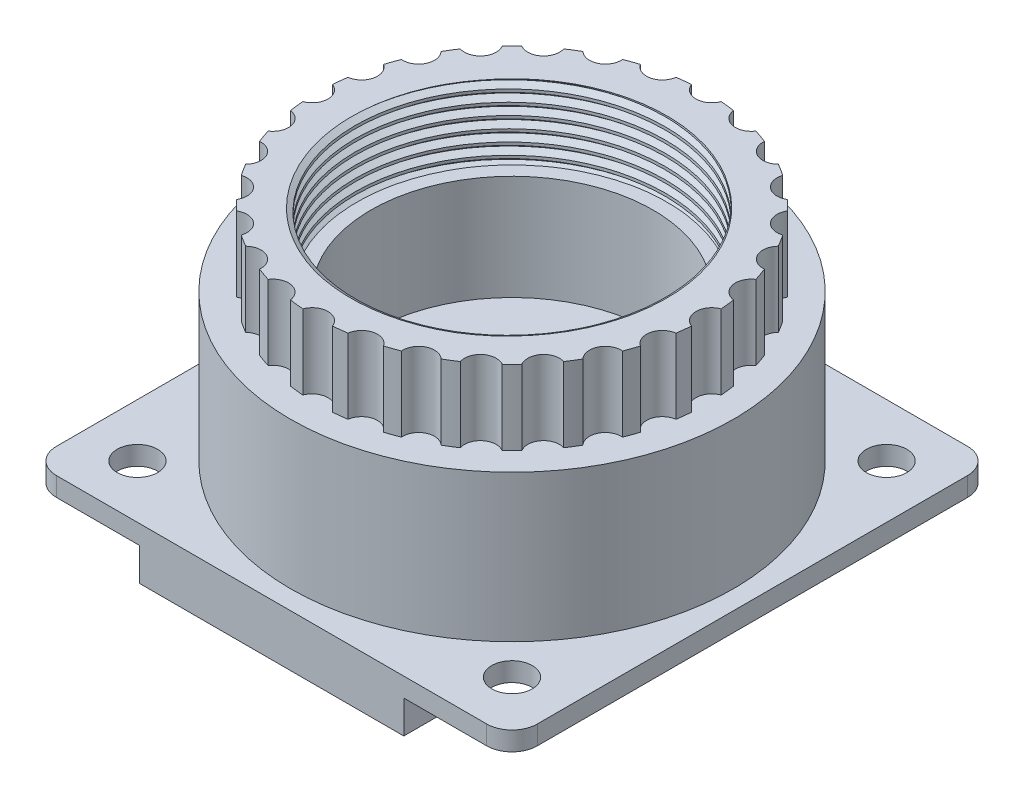
from build123d import *

# Parameters (mm, degrees)
SKETCH1_W             = 38
SKETCH1_H             = 38
SKETCH1_R             = 1.6
BOSS_EXTRUDE1_DEPTH   = 0.75
SKETCH2_W             = 20.9
SKETCH2_H             = 5.7
BOSS_EXTRUDE2_DEPTH   = 2.6
SKETCH13_W            = 7.25
SKETCH13_H            = 4.5
BOSS_EXTRUDE8_DEPTH   = 0.25
SKETCH3_R             = 1.775
BOSS_EXTRUDE3_DEPTH   = 3.25
BOSS_EXTRUDE3_2_DEPTH = 3.25
SKETCH4_R             = 17.5
SKETCH4_R_2           = 11.15
BOSS_EXTRUDE4_DEPTH   = 11.6
CUT_EXTRUDE2_START    = -1.5
SKETCH14_R            = 0.7
CUT_EXTRUDE2_DEPTH    = 6.5
SKETCH5_R             = 15.4
SKETCH5_R_2           = 12.24
BOSS_EXTRUDE5_DEPTH   = 5.9
THREAD1_PITCH         = 0.907142857
SKETCH10_R            = 1.25
CUT_EXTRUDE1_DEPTH    = 5.9
CIRPATTERN1_COUNT     = 28
SKETCH11_R            = 11.15
SKETCH11_W            = 9
SKETCH11_H            = 8
BOSS_EXTRUDE6_DEPTH   = 3.3
SKETCH15_R            = 0.7
BOSS_EXTRUDE9_DEPTH   = 6
FILLET1_R             = 2


with BuildPart() as part:
    # Sketch1 → Boss-Extrude1 (new, symmetric)
    with BuildSketch(Plane(origin=(0, 0, 0), x_dir=(1, 0, 0), z_dir=(0, 1, 0))):
        Rectangle(SKETCH1_W, SKETCH1_H)
        with Locations(Location((-14.8, 14.8, 0), (0, 0, 270))):
            Circle(SKETCH1_R, mode=Mode.SUBTRACT)
        with Locations(Location((-14.8, -14.8, 0), (0, 0, 270))):
            Circle(SKETCH1_R, mode=Mode.SUBTRACT)
        with Locations(Location((14.8, -14.8, 0), (0, 0, 270))):
            Circle(SKETCH1_R, mode=Mode.SUBTRACT)
        with Locations(Location((14.8, 14.8, 0), (0, 0, 270))):
            Circle(SKETCH1_R, mode=Mode.SUBTRACT)
    extrude(amount=BOSS_EXTRUDE1_DEPTH, both=True)

    # Sketch2 → Boss-Extrude2 (add)
    with BuildSketch(Plane.XZ.offset(0.75)):
        with Locations((0, 16.15)):
            Rectangle(SKETCH2_W, SKETCH2_H)
    extrude(amount=BOSS_EXTRUDE2_DEPTH)

    # Sketch13 → Boss-Extrude8 (add)
    with BuildSketch(Plane(origin=(0, 0.75, 0), x_dir=(1, 0, 0), z_dir=(0, 1, 0))):
        Rectangle(SKETCH13_W, SKETCH13_H)
    extrude(amount=BOSS_EXTRUDE8_DEPTH)


with BuildPart() as body_2:
    # Sketch3 → Boss-Extrude3 (new body)
    with BuildSketch(Plane.XZ.offset(0.75)):
        with Locations(Location((-12.125, 0, 0), (0, 0, 90))):
            Circle(SKETCH3_R)
    extrude(amount=BOSS_EXTRUDE3_DEPTH)


with BuildPart() as body_3:
    # Sketch3 → Boss-Extrude3 2 (new body)
    with BuildSketch(Plane.XZ.offset(0.75)):
        with Locations(Location((12.125, 0, 0), (0, 0, 90))):
            Circle(SKETCH3_R)
    extrude(amount=BOSS_EXTRUDE3_2_DEPTH)


    add(body_2.part)  # Boss-Extrude9 merges body 2
    # Sketch15 → Boss-Extrude9 (add)
    with BuildSketch(Plane(origin=(0, -0.75, 0), x_dir=(1, 0, 0), z_dir=(0, 1, 0))):
        with Locations(Location((-12.125, 0, 0), (0, 0, 270))):
            Circle(SKETCH15_R)
        with Locations(Location((12.125, 0, 0), (0, 0, 270))):
            Circle(SKETCH15_R)
    extrude(amount=BOSS_EXTRUDE9_DEPTH)


with BuildPart() as body_4:
    # Sketch4 → Boss-Extrude4 (new body)
    with BuildSketch(Plane(origin=(0, 0.75, 0), x_dir=(1, 0, 0), z_dir=(0, 1, 0))):
        with Locations(Location((0, 0, 0), (0, 0, 270))):
            Circle(SKETCH4_R)
        with Locations(Location((0, 0, 0), (0, 0, 270))):
            Circle(SKETCH4_R_2, mode=Mode.SUBTRACT)
    extrude(amount=BOSS_EXTRUDE4_DEPTH)


with BuildPart() as cut_extrude2_tool:
    # Sketch14 → Cut-Extrude2 (new body)
    with BuildSketch(Plane(origin=(0, 0.75, 0), x_dir=(1, 0, 0), z_dir=(0, 1, 0)).offset(CUT_EXTRUDE2_START)):
        with Locations(Location((-12.125, 0, 0), (0, 0, 270))):
            Circle(SKETCH14_R)
        with Locations(Location((12.125, 0, 0), (0, 0, 270))):
            Circle(SKETCH14_R)
    extrude(amount=CUT_EXTRUDE2_DEPTH)


with BuildPart() as part_1:
    add(part.part)

    # Cut-Extrude2: cut by cut_extrude2_tool
    add(cut_extrude2_tool.part, mode=Mode.SUBTRACT)

    # Fillet1
    fillet1_edges = [part_1.edges().sort_by_distance(p)[0] for p in [
        (19, 0, 19),
        (-19, 0, 19),
        (-19, 0, -19),
        (19, 0, -19),
    ]]
    fillet(fillet1_edges, radius=FILLET1_R)


with BuildPart() as body_4_1:
    add(body_4.part)

    # Cut-Extrude2: cut by cut_extrude2_tool
    add(cut_extrude2_tool.part, mode=Mode.SUBTRACT)

    # Sketch5 → Boss-Extrude5 (add)
    with BuildSketch(Plane(origin=(0, 12.35, 0), x_dir=(1, 0, 0), z_dir=(0, 1, 0))):
        with Locations(Location((0, 0, 0), (0, 0, 270))):
            Circle(SKETCH5_R)
        with Locations(Location((0, 0, 0), (0, 0, 270))):
            Circle(SKETCH5_R_2, mode=Mode.SUBTRACT)
    extrude(amount=BOSS_EXTRUDE5_DEPTH)

    # Thread1: the profile of Thread Profile1 profile screwed along a right-hand helix of 7.606299 turns, 8 arcs to a turn; built about Z, then put on its axis
    thread1_z = Axis((0, 0, 0), (0, 0, 1))
    thread1_corners = [(12.2397, 0, -0.000173205), (12.731005472, 0, 0.283482142), (12.731005472, 0, 0.396874999), (12.2397, 0, 0.680530345)]
    with BuildLine(mode=Mode.PRIVATE) as thread1_profile:
        Line(thread1_corners[0], thread1_corners[1])
        Line(thread1_corners[1], thread1_corners[2])
        Line(thread1_corners[2], thread1_corners[3])
        Line(thread1_corners[3], thread1_corners[0])
    thread1_cap = Face(thread1_profile.wire())
    thread1_turn_angles = [0, 22.5, 45, 67.5, 90, 112.5, 135, 157.5, 180, 202.5, 225, 247.5, 270, 292.5, 315, 337.5, 360]
    thread1_turn_weights = [1, 0.9238795325112867, 1, 0.9238795325112867, 1, 0.9238795325112867, 1, 0.9238795325112867, 1, 0.9238795325112867, 1, 0.9238795325112867, 1, 0.9238795325112867, 1, 0.9238795325112867, 1]
    thread1_turn_rails = [Edge.make_bspline([Vector(p[0], p[1], 0).rotate(thread1_z, thread1_turn_angles[k]) / thread1_turn_weights[k] + Vector(0, 0, p[2] + THREAD1_PITCH * thread1_turn_angles[k] / 360) for k in range(17)], [0, 0, 0, 1, 1, 2, 2, 3, 3, 4, 4, 5, 5, 6, 6, 7, 7, 8, 8, 8], 2, thread1_turn_weights) for p in thread1_corners]
    thread1_turn_sides = [Face.make_surface_from_curves(thread1_turn_rails[p[0]], thread1_turn_rails[p[1]]) for p in [(0, 1), (1, 2), (2, 3), (3, 0)]]
    thread1_last_angles = [2520, 2542.5, 2565, 2587.5, 2610, 2632.5, 2655, 2677.5, 2700, 2719.133858268, 2738.267716535]
    thread1_last_weights = [1, 0.9238795325112867, 1, 0.9238795325112867, 1, 0.9238795325112867, 1, 0.9238795325112867, 1, 0.9447553816041062, 1]
    thread1_last_rails = [Edge.make_bspline([Vector(p[0], p[1], 0).rotate(thread1_z, thread1_last_angles[k]) / thread1_last_weights[k] + Vector(0, 0, p[2] + THREAD1_PITCH * thread1_last_angles[k] / 360) for k in range(11)], [0, 0, 0, 1, 1, 2, 2, 3, 3, 4, 4, 5, 5, 5], 2, thread1_last_weights) for p in thread1_corners]
    thread1_last_sides = [Face.make_surface_from_curves(thread1_last_rails[p[0]], thread1_last_rails[p[1]]) for p in [(0, 1), (1, 2), (2, 3), (3, 0)]]
    thread1 = Plane(origin=(0, 19.25, 0), x_dir=(-1, 0, 0), z_dir=(0, -1, 0)) * Solid(Shell([*[p.moved(Location((0, 0, THREAD1_PITCH * i))) for i in range(7) for p in thread1_turn_sides], *thread1_last_sides, thread1_cap, thread1_cap.rotate(thread1_z, 2738.267716535).moved(Location((0, 0, THREAD1_PITCH * 2738.267716535 / 360)))]))
    add(thread1, mode=Mode.SUBTRACT)

    # Sketch10 → Cut-Extrude1 (cut)
    with BuildSketch(Plane(origin=(0, 18.25, 0), x_dir=(1, 0, 0), z_dir=(0, 1, 0))):
        with Locations((0, 15.79)):
            Circle(SKETCH10_R)
    cut_extrude1 = extrude(amount=-CUT_EXTRUDE1_DEPTH, mode=Mode.SUBTRACT)

    # CirPattern1: Cut-Extrude1 ×28 about axis
    cirpattern1_axis = Axis((0, 0, 0), (0, 1, 0))
    for i in range(1, CIRPATTERN1_COUNT):
        add(cut_extrude1.rotate(cirpattern1_axis, i * 360 / CIRPATTERN1_COUNT), mode=Mode.SUBTRACT)

    # Sketch11 → Boss-Extrude6 (add)
    with BuildSketch(Plane(origin=(0, 0.75, 0), x_dir=(1, 0, 0), z_dir=(0, 1, 0))):
        with Locations(Location((0, 0, 0), (0, 0, 270))):
            Circle(SKETCH11_R)
        Rectangle(SKETCH11_W, SKETCH11_H, mode=Mode.SUBTRACT)
    extrude(amount=BOSS_EXTRUDE6_DEPTH)


solid = Compound([body_3.part, part_1.part, body_4_1.part])
